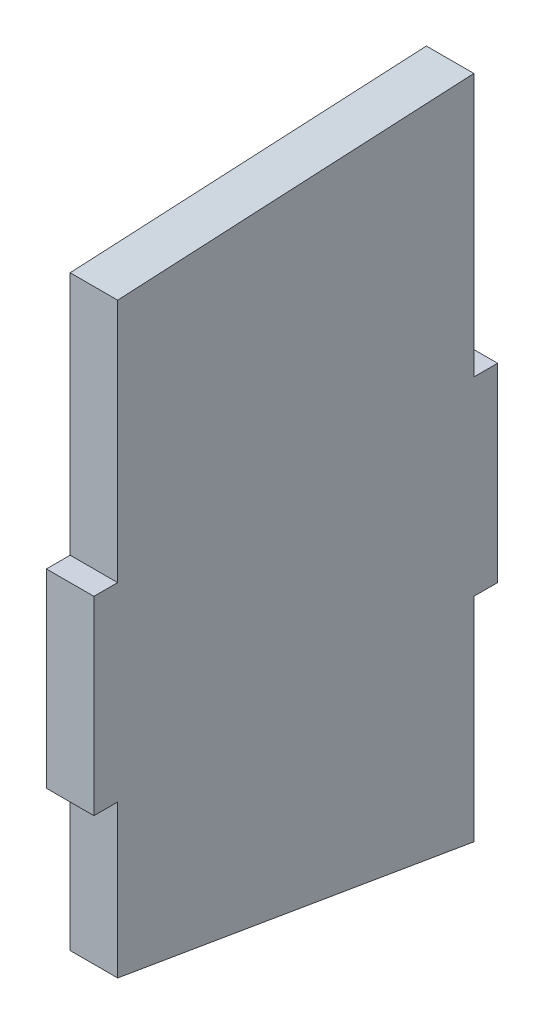
from build123d import *

# Parameters (mm, degrees)
BOSS_EXTRUDE1_DEPTH = 25.4


with BuildPart() as part:
    # Sketch1 → Boss-Extrude1 (new body)
    with BuildSketch(Plane(origin=(0, 0, 0), x_dir=(0, 0, -1), z_dir=(1, 0, 0))):
        Polygon((95.25, 191.38745187), (-95.25, 181.62487678), (-95.25, 50.8), (-107.95, 50.8), (-107.95, -50.8), (-95.25, -50.8), (-95.25, -132.320724436), (95.25, -164.508767502), (95.25, -50.8), (107.95, -50.8), (107.95, 50.8), (95.25, 50.8), align=None)
    extrude(amount=BOSS_EXTRUDE1_DEPTH)


solid = part.part
